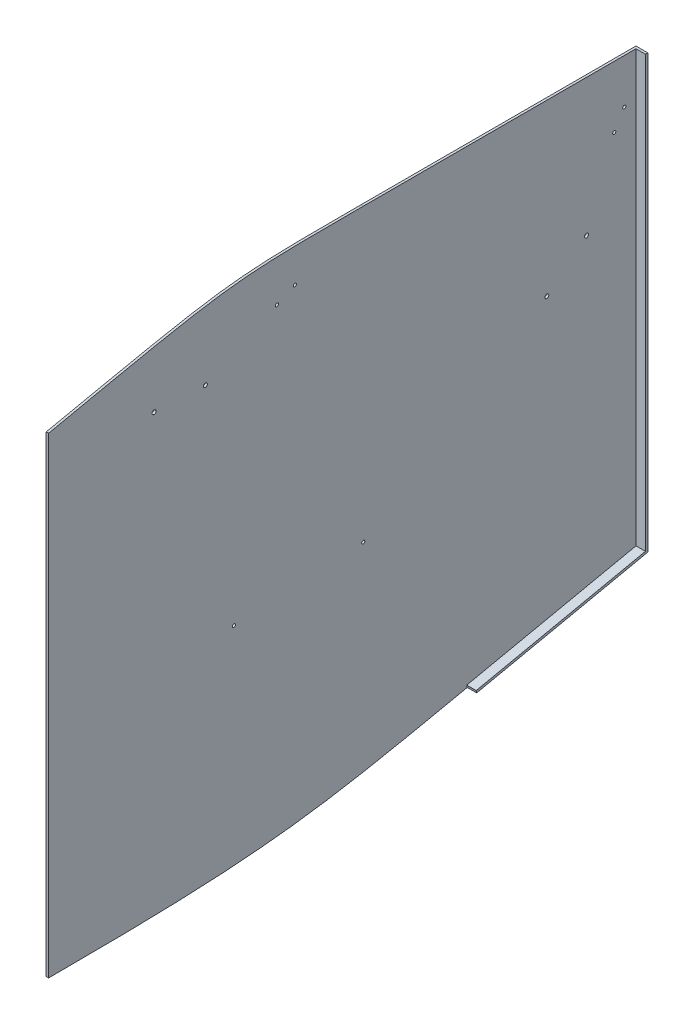
from build123d import *

# Parameters (mm, degrees)
BOSS_EXTRUDE1_START     = -3
BOSS_EXTRUDE1_DEPTH     = 3
BOSS_EXTRUDE2_DEPTH     = 12
CUT_EXTRUDE1_DEPTH      = 498.153256686
CUT_EXTRUDE1_DEPTH_BACK = 498.153256686
SKETCH4_R               = 2
SKETCH4_R_2             = 2.5


# Read off the part's stored shape, not the designer's step: Boss-Extrude1
with BuildPart() as part:
    # Boss-Extrude1 outline → Boss-Extrude1 (new body)
    with BuildSketch(Plane(origin=(0, 0, 0), x_dir=(0, 0, -1), z_dir=(1, 0, 0)).offset(BOSS_EXTRUDE1_START)):
        with BuildLine():
            Line((374.921925096, 326.088635526), (24.921925096, 326.088635526))
            add(Edge.make_bspline(
                [(24.921925096, 326.088635526), (-144.675070379, 326.088635526), (-139.84656943, 326.088635526), (-375.078074904, 276.088635526)],
                knots=[0, 0, 0, 0, 1, 1, 1, 1], degree=3))
            Line((-375.078074904, 276.088635526), (-375.078074904, -323.911364474))
            add(Edge.make_bspline(
                [(-375.078074904, -323.911364474), (-95.541085852, -323.911364474), (-35.062480537, -311.056240074), (157.348776273, -270.157964899)],
                knots=[0, 0, 0, 0, 1, 1, 1, 1], degree=3))
            Line((157.348776273, -270.157964899), (374.921925096, -223.911364474))
            Line((374.921925096, -223.911364474), (374.921925096, 326.088635526))
        make_face()
    extrude(amount=BOSS_EXTRUDE1_DEPTH)

    # Sketch3 → Boss-Extrude2 (add)
    with BuildSketch(Plane(origin=(0, 0, 0), x_dir=(0, 0, -1), z_dir=(1, 0, 0))):
        Polygon((157.348776273, -270.157964899), (374.921925096, -223.911364474), (374.921925096, 326.088635526), (371.921925096, 326.088635526), (371.921925096, -221.482012374), (156.725041201, -267.223522097), align=None)
    extrude(amount=BOSS_EXTRUDE2_DEPTH)

    # Sketch4 → Cut-Extrude1 (cut, two sides: drawn at the far end of the back side and taken through both)
    with BuildSketch(Plane(origin=(0, 0, 0), x_dir=(0, 0, -1), z_dir=(1, 0, 0)).offset(-CUT_EXTRUDE1_DEPTH_BACK)):
        with Locations((25.083553444, -44.01739539)):
            Circle(SKETCH4_R)
        with Locations((357.01536917, 269.230000887)):
            Circle(SKETCH4_R)
        with Locations((344.332369965, 247.678292183)):
            Circle(SKETCH4_R)
        with Locations((309.057260956, 151.668432327)):
            Circle(SKETCH4_R_2)
        with Locations((258.591204121, 110.126241652)):
            Circle(SKETCH4_R_2)
        with Locations((-61.91870145, 282.615467423)):
            Circle(SKETCH4_R)
        with Locations((-84.669558452, 272.236010663)):
            Circle(SKETCH4_R)
        with Locations((-175.680236141, 229.281564523)):
            Circle(SKETCH4_R_2)
        with Locations((-240.980976375, 232.178083695)):
            Circle(SKETCH4_R_2)
        with Locations((-139.344950951, -53.676954932)):
            Circle(SKETCH4_R)
    extrude(amount=CUT_EXTRUDE1_DEPTH + CUT_EXTRUDE1_DEPTH_BACK, mode=Mode.SUBTRACT)


solid = part.part
